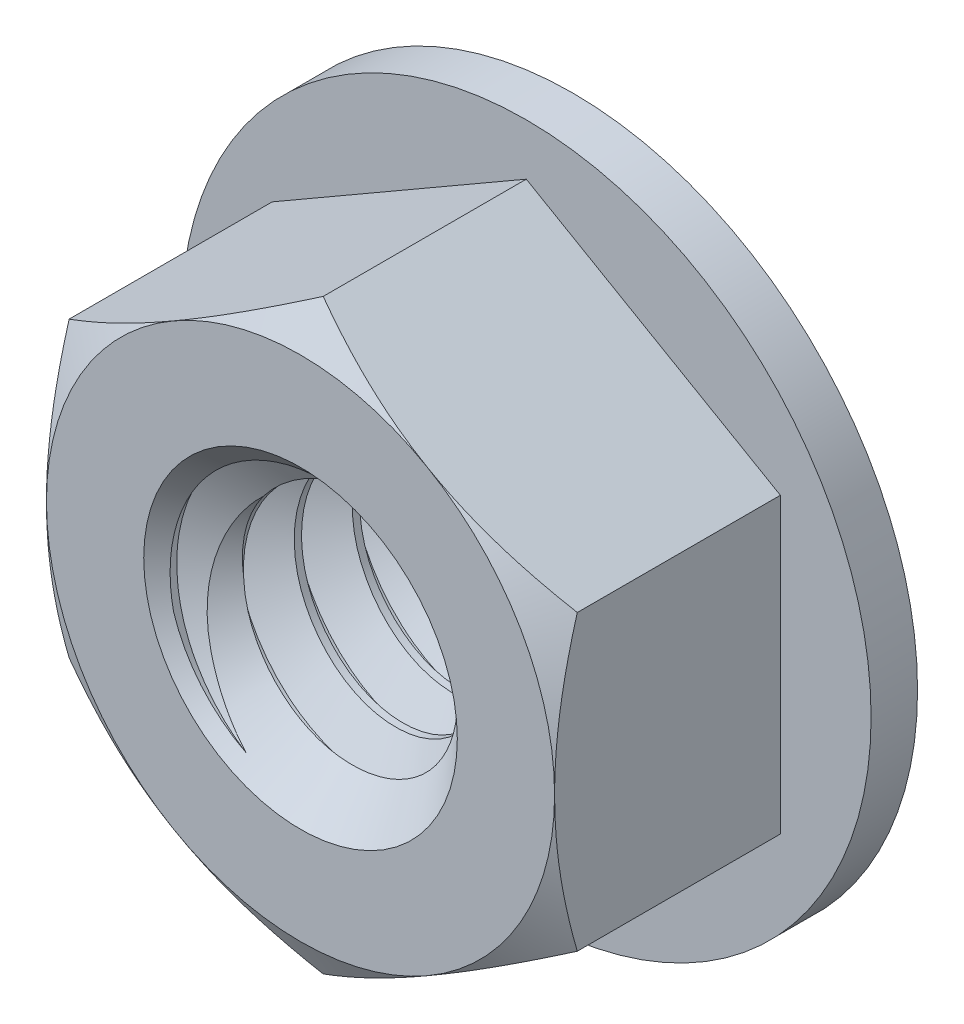
from build123d import *

# Parameters (mm, degrees)
EXTRUDE1_DEPTH     = 5.953125
SKETCH13_R         = 7.540625
EXTRUDE3_DEPTH     = 1.016
SKETCH2_OUTSIDE_W  = 67.282
SKETCH2_OUTSIDE_H  = 67.282
SKETCH2_OUTSIDE_R  = 5.55625
CUT_EXTRUDE1_DEPTH = 13.213179277
CUT_EXTRUDE1_DRAFT = -60
SKETCH4_R          = 3.175
CUT_EXTRUDE3_DEPTH = 13.213179277
SKETCH12_R         = 3.175
SKETCH12_R_2       = 2.350110803
EXTRUDE2_DEPTH     = 5.953125
CUT_SWEEP1_PITCH   = 1.27


with BuildPart() as part:
    # Sketch1 → Extrude1 (new body)
    with BuildSketch(Plane.XY):
        Polygon((0, 6.415804866), (-5.55625, 3.207902433), (-5.55625, -3.207902433), (0, -6.415804866), (5.55625, -3.207902433), (5.55625, 3.207902433), align=None)
    extrude(amount=-EXTRUDE1_DEPTH)

    # Sketch13 → Extrude3 (add)
    with BuildSketch(Plane(origin=(0, 0, -5.953125), x_dir=(-1, 0, 0), z_dir=(0, 0, -1))):
        Circle(SKETCH13_R)
    extrude(amount=-EXTRUDE3_DEPTH)


with BuildPart() as cut_extrude1_tool:
    # Sketch2 outside → Cut-Extrude1 (with draft: the straight prism first)
    with BuildSketch(Plane.XY):
        Rectangle(SKETCH2_OUTSIDE_W, SKETCH2_OUTSIDE_H)
        Circle(SKETCH2_OUTSIDE_R, mode=Mode.SUBTRACT)
    extrude(amount=-CUT_EXTRUDE1_DEPTH)
    # Cut-Extrude1: the draft: its side faces are tilted about the plane it starts from
    cut_extrude1_sides = [cut_extrude1_tool.faces().sort_by_distance(p)[0] for p in [
        (0, -33.641, -6.606589638),
        (33.641, 0, -6.606589638),
        (0, 33.641, -6.606589638),
        (-33.641, 0, -6.606589638),
        (-5.55625, 0, -6.606589638),
    ]]
    draft(cut_extrude1_sides, Plane.XY, CUT_EXTRUDE1_DRAFT)


with BuildPart() as part_1:
    add(part.part)

    # Cut-Extrude1: cut by cut_extrude1_tool
    add(cut_extrude1_tool.part, mode=Mode.SUBTRACT)

    # Sketch4 → Cut-Extrude3 (cut, through all)
    with BuildSketch(Plane.XY):
        Circle(SKETCH4_R)
    extrude(amount=-CUT_EXTRUDE3_DEPTH, mode=Mode.SUBTRACT)

    # Sketch12 → Extrude2 (add)
    with BuildSketch(Plane.XY):
        Circle(SKETCH12_R)
        Circle(SKETCH12_R_2, mode=Mode.SUBTRACT)
    extrude(amount=-EXTRUDE2_DEPTH)

    # Cut-Sweep1: the profile of Sketch9 profile screwed along a right-hand helix of 5.6875 turns, 6 arcs to a turn; built about Z, then put on its axis
    cut_sweep1_z = Axis((0, 0, 0), (0, 0, 1))
    cut_sweep1_corners = [(3.175, 0, -0.635), (3.175, 0, -0.47625), (2.349810803, 0, 0.000173205), (2.349810803, 0, -1.111423205)]
    with BuildLine(mode=Mode.PRIVATE) as cut_sweep1_profile:
        Line(cut_sweep1_corners[0], cut_sweep1_corners[1])
        Line(cut_sweep1_corners[1], cut_sweep1_corners[2])
        Line(cut_sweep1_corners[2], cut_sweep1_corners[3])
        Line(cut_sweep1_corners[3], cut_sweep1_corners[0])
    cut_sweep1_cap = Face(cut_sweep1_profile.wire())
    cut_sweep1_turn_angles = [0, 30, 60, 90, 120, 150, 180, 210, 240, 270, 300, 330, 360]
    cut_sweep1_turn_weights = [1, 0.8660254037844387, 1, 0.8660254037844387, 1, 0.8660254037844387, 1, 0.8660254037844387, 1, 0.8660254037844387, 1, 0.8660254037844387, 1]
    cut_sweep1_turn_rails = [Edge.make_bspline([Vector(p[0], p[1], 0).rotate(cut_sweep1_z, cut_sweep1_turn_angles[k]) / cut_sweep1_turn_weights[k] + Vector(0, 0, p[2] + CUT_SWEEP1_PITCH * cut_sweep1_turn_angles[k] / 360) for k in range(13)], [0, 0, 0, 1, 1, 2, 2, 3, 3, 4, 4, 5, 5, 6, 6, 6], 2, cut_sweep1_turn_weights) for p in cut_sweep1_corners]
    cut_sweep1_turn_sides = [Face.make_surface_from_curves(cut_sweep1_turn_rails[p[0]], cut_sweep1_turn_rails[p[1]]) for p in [(0, 1), (1, 2), (2, 3), (3, 0)]]
    cut_sweep1_last_angles = [1800, 1830, 1860, 1890, 1920, 1950, 1980, 2010, 2040, 2043.75, 2047.5]
    cut_sweep1_last_weights = [1, 0.8660254037844387, 1, 0.8660254037844387, 1, 0.8660254037844387, 1, 0.8660254037844387, 1, 0.9978589232386016, 1]
    cut_sweep1_last_rails = [Edge.make_bspline([Vector(p[0], p[1], 0).rotate(cut_sweep1_z, cut_sweep1_last_angles[k]) / cut_sweep1_last_weights[k] + Vector(0, 0, p[2] + CUT_SWEEP1_PITCH * cut_sweep1_last_angles[k] / 360) for k in range(11)], [0, 0, 0, 1, 1, 2, 2, 3, 3, 4, 4, 5, 5, 5], 2, cut_sweep1_last_weights) for p in cut_sweep1_corners]
    cut_sweep1_last_sides = [Face.make_surface_from_curves(cut_sweep1_last_rails[p[0]], cut_sweep1_last_rails[p[1]]) for p in [(0, 1), (1, 2), (2, 3), (3, 0)]]
    cut_sweep1 = Plane(origin=(0, 0, 0), x_dir=(0, 1, 0), z_dir=(0, 0, -1)) * Solid(Shell([*[p.moved(Location((0, 0, CUT_SWEEP1_PITCH * i))) for i in range(5) for p in cut_sweep1_turn_sides], *cut_sweep1_last_sides, cut_sweep1_cap, cut_sweep1_cap.rotate(cut_sweep1_z, 2047.5).moved(Location((0, 0, CUT_SWEEP1_PITCH * 2047.5 / 360)))]))
    add(cut_sweep1, mode=Mode.SUBTRACT)

    # Cut-Extrude6 cone 1 section (through the dimple's axis) → Cut-Extrude6 (revolve, cut)
    with BuildSketch(Plane(origin=(0, 0, 0), x_dir=(0, -1, 0), z_dir=(1, 0, 0))):
        Polygon((0, 0), (3.429, 0), (0, 3.429), align=None)
    revolve(axis=Axis((0, 0, 0), (0, 0, -1)), mode=Mode.SUBTRACT)

    # Cut-Extrude7 cone 1 section (through the dimple's axis) → Cut-Extrude7 (revolve, cut)
    with BuildSketch(Plane(origin=(0, 0, -5.953125), x_dir=(0, 1, 0), z_dir=(1, 0, 0))):
        Polygon((0, 0), (3.429, 0), (0, 3.429), align=None)
    revolve(axis=Axis((0, 0, -5.953125), (0, 0, 1)), mode=Mode.SUBTRACT)


solid = part_1.part
